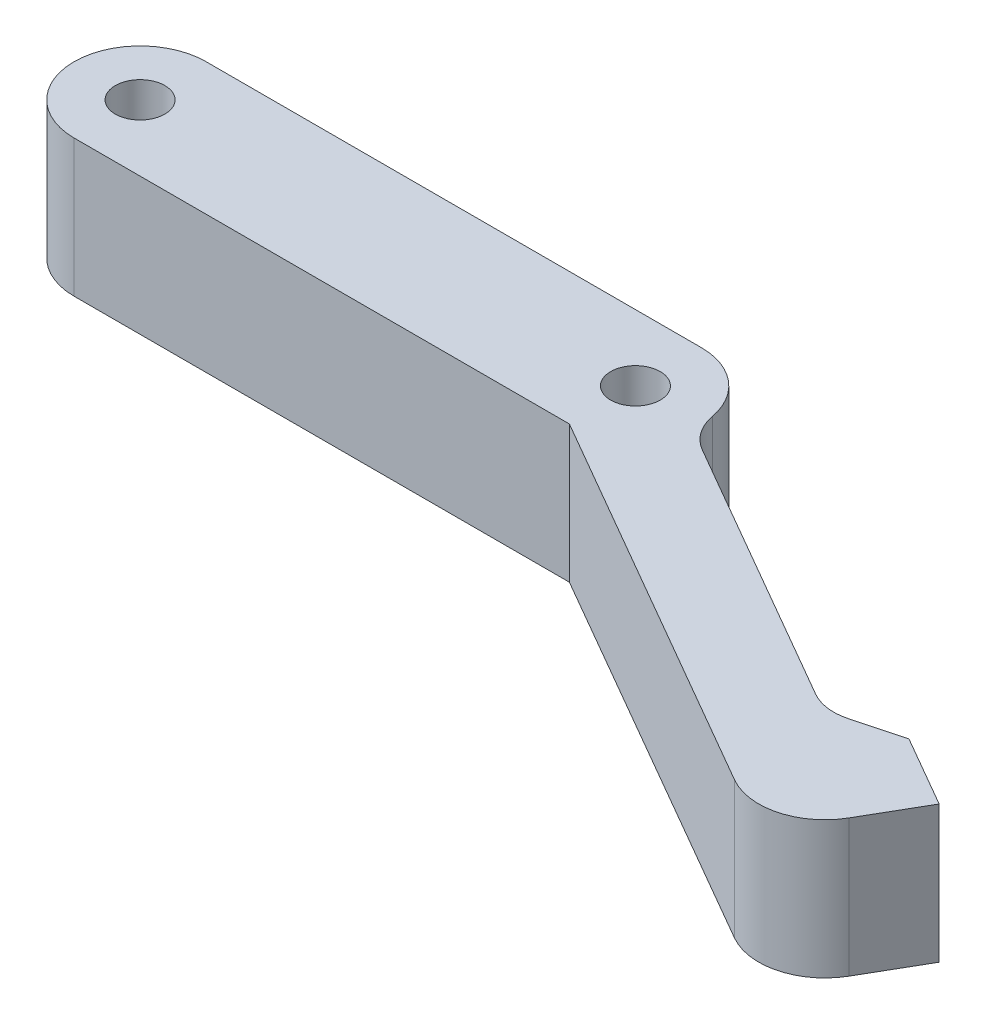
from build123d import *

# Parameters (mm, degrees)
SKETCH1_R           = 1.5
BOSS_EXTRUDE1_DEPTH = 8.3
FILLET1_R           = 3


with BuildPart() as part:
    # Sketch1 → Boss-Extrude1 (new body)
    with BuildSketch(Plane(origin=(0, 0, 0), x_dir=(1, 0, 0), z_dir=(0, 1, 0))):
        with BuildLine():
            Line((30, 4), (0, 4))
            ThreePointArc((0, 4), (-4, 0), (0, -4))
            Line((0, -4), (30, -4))
            Line((30, -4), (53.663264889, -17.661992354))
            ThreePointArc((53.663264889, -17.661992354), (56.69854107, -18.061594044), (59.127366504, -16.197890739))
            Line((59.127366504, -16.197890739), (61.127366504, -12.733789123))
            Line((61.127366504, -12.733789123), (56.797239485, -10.233789123))
            Line((56.797239485, -10.233789123), (52.699163274, -11.331865335))
            Line((52.699163274, -11.331865335), (33.966505447, -0.516560296))
            ThreePointArc((33.966505447, -0.516560296), (33.005515029, 2.639484686), (30, 4))
        make_face()
        Circle(SKETCH1_R, mode=Mode.SUBTRACT)
        with Locations((30, 0)):
            Circle(SKETCH1_R, mode=Mode.SUBTRACT)
    extrude(amount=BOSS_EXTRUDE1_DEPTH)

    # Fillet1
    fillet1_edges = [part.edges().sort_by_distance(p)[0] for p in [
        (52.699163274, 4.15, 11.331865335),
        (33.966505447, 4.15, 0.516560296),
    ]]
    fillet(fillet1_edges, radius=FILLET1_R)


solid = part.part
